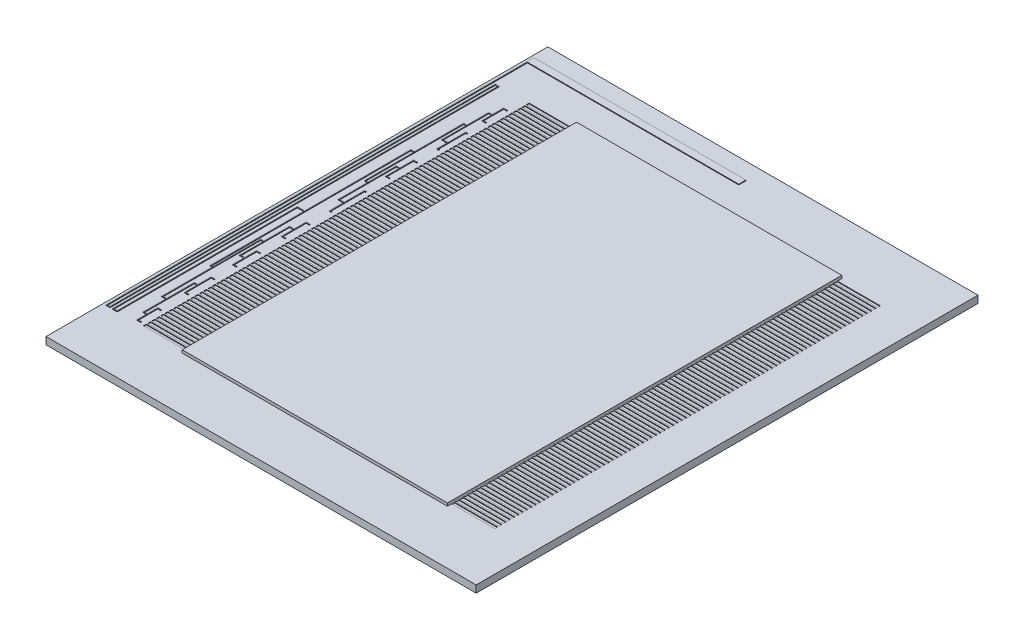
from build123d import *

# Parameters (mm, degrees)
SKETCH2_W           = 30
SKETCH2_H           = 35
BOSS_EXTRUDE1_DEPTH = 0.5
SKETCH4_W           = 3
SKETCH4_H           = 0.2
CUT_EXTRUDE1_DEPTH  = 0.05
SKETCH3_W           = 18.5
SKETCH3_H           = 27.5
BOSS_EXTRUDE5_DEPTH = 0.2
BOSS_EXTRUDE6_DEPTH = 0.05


with BuildPart() as part:
    # Sketch2 → Boss-Extrude1 (new body)
    with BuildSketch(Plane(origin=(0, 0, 0), x_dir=(1, 0, 0), z_dir=(0, 1, 0))):
        Rectangle(SKETCH2_W, SKETCH2_H)
    extrude(amount=-BOSS_EXTRUDE1_DEPTH)

    # Sketch4 → Cut-Extrude1 (cut)
    with BuildSketch(Plane(origin=(0, 0, 0), x_dir=(1, 0, 0), z_dir=(0, 1, 0))):
        with Locations((10.75, 13.35)):
            Rectangle(SKETCH4_W, SKETCH4_H)
        with Locations((10.75, 13.05)):
            Rectangle(SKETCH4_W, SKETCH4_H)
        with Locations((10.75, 12.75)):
            Rectangle(SKETCH4_W, SKETCH4_H)
        with Locations((10.75, 12.45)):
            Rectangle(SKETCH4_W, SKETCH4_H)
        with Locations((10.75, 12.15)):
            Rectangle(SKETCH4_W, SKETCH4_H)
        with Locations((10.75, 11.85)):
            Rectangle(SKETCH4_W, SKETCH4_H)
        with Locations((10.75, 11.55)):
            Rectangle(SKETCH4_W, SKETCH4_H)
        with Locations((10.75, 11.25)):
            Rectangle(SKETCH4_W, SKETCH4_H)
        with Locations((10.75, 10.95)):
            Rectangle(SKETCH4_W, SKETCH4_H)
        with Locations((10.75, 10.65)):
            Rectangle(SKETCH4_W, SKETCH4_H)
        with Locations((10.75, 10.35)):
            Rectangle(SKETCH4_W, SKETCH4_H)
        with Locations((10.75, 10.05)):
            Rectangle(SKETCH4_W, SKETCH4_H)
        with Locations((10.75, 9.75)):
            Rectangle(SKETCH4_W, SKETCH4_H)
        with Locations((10.75, 9.45)):
            Rectangle(SKETCH4_W, SKETCH4_H)
        with Locations((10.75, 9.15)):
            Rectangle(SKETCH4_W, SKETCH4_H)
        with Locations((10.75, 8.85)):
            Rectangle(SKETCH4_W, SKETCH4_H)
        with Locations((10.75, 8.55)):
            Rectangle(SKETCH4_W, SKETCH4_H)
        with Locations((10.75, 8.25)):
            Rectangle(SKETCH4_W, SKETCH4_H)
        with Locations((10.75, 7.95)):
            Rectangle(SKETCH4_W, SKETCH4_H)
        with Locations((10.75, 7.65)):
            Rectangle(SKETCH4_W, SKETCH4_H)
        with Locations((10.75, 7.35)):
            Rectangle(SKETCH4_W, SKETCH4_H)
        with Locations((10.75, 7.05)):
            Rectangle(SKETCH4_W, SKETCH4_H)
        with Locations((10.75, 6.75)):
            Rectangle(SKETCH4_W, SKETCH4_H)
        with Locations((10.75, 6.45)):
            Rectangle(SKETCH4_W, SKETCH4_H)
        with Locations((10.75, 6.15)):
            Rectangle(SKETCH4_W, SKETCH4_H)
        with Locations((10.75, 5.85)):
            Rectangle(SKETCH4_W, SKETCH4_H)
        with Locations((10.75, 5.55)):
            Rectangle(SKETCH4_W, SKETCH4_H)
        with Locations((10.75, 5.25)):
            Rectangle(SKETCH4_W, SKETCH4_H)
        with Locations((10.75, 4.95)):
            Rectangle(SKETCH4_W, SKETCH4_H)
        with Locations((10.75, 4.65)):
            Rectangle(SKETCH4_W, SKETCH4_H)
        with Locations((10.75, 4.35)):
            Rectangle(SKETCH4_W, SKETCH4_H)
        with Locations((10.75, 4.05)):
            Rectangle(SKETCH4_W, SKETCH4_H)
        with Locations((10.75, 3.75)):
            Rectangle(SKETCH4_W, SKETCH4_H)
        with Locations((10.75, 3.45)):
            Rectangle(SKETCH4_W, SKETCH4_H)
        with Locations((10.75, 3.15)):
            Rectangle(SKETCH4_W, SKETCH4_H)
        with Locations((10.75, 2.85)):
            Rectangle(SKETCH4_W, SKETCH4_H)
        with Locations((10.75, 2.55)):
            Rectangle(SKETCH4_W, SKETCH4_H)
        with Locations((10.75, 2.25)):
            Rectangle(SKETCH4_W, SKETCH4_H)
        with Locations((10.75, 1.95)):
            Rectangle(SKETCH4_W, SKETCH4_H)
        with Locations((10.75, 1.65)):
            Rectangle(SKETCH4_W, SKETCH4_H)
        with Locations((10.75, 1.35)):
            Rectangle(SKETCH4_W, SKETCH4_H)
        with Locations((10.75, 1.05)):
            Rectangle(SKETCH4_W, SKETCH4_H)
        with Locations((10.75, 0.75)):
            Rectangle(SKETCH4_W, SKETCH4_H)
        with Locations((10.75, 0.45)):
            Rectangle(SKETCH4_W, SKETCH4_H)
        with Locations((10.75, 0.15)):
            Rectangle(SKETCH4_W, SKETCH4_H)
        with Locations((10.75, -0.15)):
            Rectangle(SKETCH4_W, SKETCH4_H)
        with Locations((10.75, -0.45)):
            Rectangle(SKETCH4_W, SKETCH4_H)
        with Locations((10.75, -0.75)):
            Rectangle(SKETCH4_W, SKETCH4_H)
        with Locations((10.75, -1.05)):
            Rectangle(SKETCH4_W, SKETCH4_H)
        with Locations((10.75, -1.35)):
            Rectangle(SKETCH4_W, SKETCH4_H)
        with Locations((10.75, -1.65)):
            Rectangle(SKETCH4_W, SKETCH4_H)
        with Locations((10.75, -1.95)):
            Rectangle(SKETCH4_W, SKETCH4_H)
        with Locations((10.75, -2.25)):
            Rectangle(SKETCH4_W, SKETCH4_H)
        with Locations((10.75, -2.55)):
            Rectangle(SKETCH4_W, SKETCH4_H)
        with Locations((10.75, -2.85)):
            Rectangle(SKETCH4_W, SKETCH4_H)
        with Locations((10.75, -3.15)):
            Rectangle(SKETCH4_W, SKETCH4_H)
        with Locations((10.75, -3.45)):
            Rectangle(SKETCH4_W, SKETCH4_H)
        with Locations((10.75, -3.75)):
            Rectangle(SKETCH4_W, SKETCH4_H)
        with Locations((10.75, -4.05)):
            Rectangle(SKETCH4_W, SKETCH4_H)
        with Locations((10.75, -4.35)):
            Rectangle(SKETCH4_W, SKETCH4_H)
        with Locations((10.75, -4.65)):
            Rectangle(SKETCH4_W, SKETCH4_H)
        with Locations((10.75, -4.95)):
            Rectangle(SKETCH4_W, SKETCH4_H)
        with Locations((10.75, -5.25)):
            Rectangle(SKETCH4_W, SKETCH4_H)
        with Locations((10.75, -5.55)):
            Rectangle(SKETCH4_W, SKETCH4_H)
        with Locations((10.75, -5.85)):
            Rectangle(SKETCH4_W, SKETCH4_H)
        with Locations((10.75, -6.15)):
            Rectangle(SKETCH4_W, SKETCH4_H)
        with Locations((10.75, -6.45)):
            Rectangle(SKETCH4_W, SKETCH4_H)
        with Locations((10.75, -6.75)):
            Rectangle(SKETCH4_W, SKETCH4_H)
        with Locations((10.75, -7.05)):
            Rectangle(SKETCH4_W, SKETCH4_H)
        with Locations((10.75, -7.35)):
            Rectangle(SKETCH4_W, SKETCH4_H)
        with Locations((10.75, -7.65)):
            Rectangle(SKETCH4_W, SKETCH4_H)
        with Locations((10.75, -7.95)):
            Rectangle(SKETCH4_W, SKETCH4_H)
        with Locations((10.75, -8.25)):
            Rectangle(SKETCH4_W, SKETCH4_H)
        with Locations((10.75, -8.55)):
            Rectangle(SKETCH4_W, SKETCH4_H)
        with Locations((10.75, -8.85)):
            Rectangle(SKETCH4_W, SKETCH4_H)
        with Locations((10.75, -9.15)):
            Rectangle(SKETCH4_W, SKETCH4_H)
        with Locations((10.75, -9.45)):
            Rectangle(SKETCH4_W, SKETCH4_H)
        with Locations((10.75, -9.75)):
            Rectangle(SKETCH4_W, SKETCH4_H)
        with Locations((10.75, -10.05)):
            Rectangle(SKETCH4_W, SKETCH4_H)
        with Locations((10.75, -10.35)):
            Rectangle(SKETCH4_W, SKETCH4_H)
        with Locations((10.75, -10.65)):
            Rectangle(SKETCH4_W, SKETCH4_H)
        with Locations((10.75, -10.95)):
            Rectangle(SKETCH4_W, SKETCH4_H)
        with Locations((10.75, -11.25)):
            Rectangle(SKETCH4_W, SKETCH4_H)
        with Locations((10.75, -11.55)):
            Rectangle(SKETCH4_W, SKETCH4_H)
        with Locations((10.75, -11.85)):
            Rectangle(SKETCH4_W, SKETCH4_H)
        with Locations((10.75, -12.15)):
            Rectangle(SKETCH4_W, SKETCH4_H)
        with Locations((10.75, -12.45)):
            Rectangle(SKETCH4_W, SKETCH4_H)
        with Locations((10.75, -12.75)):
            Rectangle(SKETCH4_W, SKETCH4_H)
        with Locations((10.75, -13.05)):
            Rectangle(SKETCH4_W, SKETCH4_H)
        with Locations((10.75, -13.35)):
            Rectangle(SKETCH4_W, SKETCH4_H)
        with Locations((-10.75, 13.35)):
            Rectangle(SKETCH4_W, SKETCH4_H)
        with Locations((-10.75, 13.05)):
            Rectangle(SKETCH4_W, SKETCH4_H)
        with Locations((-10.75, 12.75)):
            Rectangle(SKETCH4_W, SKETCH4_H)
        with Locations((-10.75, 12.45)):
            Rectangle(SKETCH4_W, SKETCH4_H)
        with Locations((-10.75, 12.15)):
            Rectangle(SKETCH4_W, SKETCH4_H)
        with Locations((-10.75, 11.85)):
            Rectangle(SKETCH4_W, SKETCH4_H)
        with Locations((-10.75, 11.55)):
            Rectangle(SKETCH4_W, SKETCH4_H)
        with Locations((-10.75, 11.25)):
            Rectangle(SKETCH4_W, SKETCH4_H)
        with Locations((-10.75, 10.95)):
            Rectangle(SKETCH4_W, SKETCH4_H)
        with Locations((-10.75, 10.65)):
            Rectangle(SKETCH4_W, SKETCH4_H)
        with Locations((-10.75, 10.35)):
            Rectangle(SKETCH4_W, SKETCH4_H)
        with Locations((-10.75, 10.05)):
            Rectangle(SKETCH4_W, SKETCH4_H)
        with Locations((-10.75, 9.75)):
            Rectangle(SKETCH4_W, SKETCH4_H)
        with Locations((-10.75, 9.45)):
            Rectangle(SKETCH4_W, SKETCH4_H)
        with Locations((-10.75, 9.15)):
            Rectangle(SKETCH4_W, SKETCH4_H)
        with Locations((-10.75, 8.85)):
            Rectangle(SKETCH4_W, SKETCH4_H)
        with Locations((-10.75, 8.55)):
            Rectangle(SKETCH4_W, SKETCH4_H)
        with Locations((-10.75, 8.25)):
            Rectangle(SKETCH4_W, SKETCH4_H)
        with Locations((-10.75, 7.95)):
            Rectangle(SKETCH4_W, SKETCH4_H)
        with Locations((-10.75, 7.65)):
            Rectangle(SKETCH4_W, SKETCH4_H)
        with Locations((-10.75, 7.35)):
            Rectangle(SKETCH4_W, SKETCH4_H)
        with Locations((-10.75, 7.05)):
            Rectangle(SKETCH4_W, SKETCH4_H)
        with Locations((-10.75, 6.75)):
            Rectangle(SKETCH4_W, SKETCH4_H)
        with Locations((-10.75, 6.45)):
            Rectangle(SKETCH4_W, SKETCH4_H)
        with Locations((-10.75, 6.15)):
            Rectangle(SKETCH4_W, SKETCH4_H)
        with Locations((-10.75, 5.85)):
            Rectangle(SKETCH4_W, SKETCH4_H)
        with Locations((-10.75, 5.55)):
            Rectangle(SKETCH4_W, SKETCH4_H)
        with Locations((-10.75, 5.25)):
            Rectangle(SKETCH4_W, SKETCH4_H)
        with Locations((-10.75, 4.95)):
            Rectangle(SKETCH4_W, SKETCH4_H)
        with Locations((-10.75, 4.65)):
            Rectangle(SKETCH4_W, SKETCH4_H)
        with Locations((-10.75, 4.35)):
            Rectangle(SKETCH4_W, SKETCH4_H)
        with Locations((-10.75, 4.05)):
            Rectangle(SKETCH4_W, SKETCH4_H)
        with Locations((-10.75, 3.75)):
            Rectangle(SKETCH4_W, SKETCH4_H)
        with Locations((-10.75, 3.45)):
            Rectangle(SKETCH4_W, SKETCH4_H)
        with Locations((-10.75, 3.15)):
            Rectangle(SKETCH4_W, SKETCH4_H)
        with Locations((-10.75, 2.85)):
            Rectangle(SKETCH4_W, SKETCH4_H)
        with Locations((-10.75, 2.55)):
            Rectangle(SKETCH4_W, SKETCH4_H)
        with Locations((-10.75, 2.25)):
            Rectangle(SKETCH4_W, SKETCH4_H)
        with Locations((-10.75, 1.95)):
            Rectangle(SKETCH4_W, SKETCH4_H)
        with Locations((-10.75, 1.65)):
            Rectangle(SKETCH4_W, SKETCH4_H)
        with Locations((-10.75, 1.35)):
            Rectangle(SKETCH4_W, SKETCH4_H)
        with Locations((-10.75, 1.05)):
            Rectangle(SKETCH4_W, SKETCH4_H)
        with Locations((-10.75, 0.75)):
            Rectangle(SKETCH4_W, SKETCH4_H)
        with Locations((-10.75, 0.45)):
            Rectangle(SKETCH4_W, SKETCH4_H)
        with Locations((-10.75, 0.15)):
            Rectangle(SKETCH4_W, SKETCH4_H)
        with Locations((-10.75, -0.15)):
            Rectangle(SKETCH4_W, SKETCH4_H)
        with Locations((-10.75, -0.45)):
            Rectangle(SKETCH4_W, SKETCH4_H)
        with Locations((-10.75, -0.75)):
            Rectangle(SKETCH4_W, SKETCH4_H)
        with Locations((-10.75, -1.05)):
            Rectangle(SKETCH4_W, SKETCH4_H)
        with Locations((-10.75, -1.35)):
            Rectangle(SKETCH4_W, SKETCH4_H)
        with Locations((-10.75, -1.65)):
            Rectangle(SKETCH4_W, SKETCH4_H)
        with Locations((-10.75, -1.95)):
            Rectangle(SKETCH4_W, SKETCH4_H)
        with Locations((-10.75, -2.25)):
            Rectangle(SKETCH4_W, SKETCH4_H)
        with Locations((-10.75, -2.55)):
            Rectangle(SKETCH4_W, SKETCH4_H)
        with Locations((-10.75, -2.85)):
            Rectangle(SKETCH4_W, SKETCH4_H)
        with Locations((-10.75, -3.15)):
            Rectangle(SKETCH4_W, SKETCH4_H)
        with Locations((-10.75, -3.45)):
            Rectangle(SKETCH4_W, SKETCH4_H)
        with Locations((-10.75, -3.75)):
            Rectangle(SKETCH4_W, SKETCH4_H)
        with Locations((-10.75, -4.05)):
            Rectangle(SKETCH4_W, SKETCH4_H)
        with Locations((-10.75, -4.35)):
            Rectangle(SKETCH4_W, SKETCH4_H)
        with Locations((-10.75, -4.65)):
            Rectangle(SKETCH4_W, SKETCH4_H)
        with Locations((-10.75, -4.95)):
            Rectangle(SKETCH4_W, SKETCH4_H)
        with Locations((-10.75, -5.25)):
            Rectangle(SKETCH4_W, SKETCH4_H)
        with Locations((-10.75, -5.55)):
            Rectangle(SKETCH4_W, SKETCH4_H)
        with Locations((-10.75, -5.85)):
            Rectangle(SKETCH4_W, SKETCH4_H)
        with Locations((-10.75, -6.15)):
            Rectangle(SKETCH4_W, SKETCH4_H)
        with Locations((-10.75, -6.45)):
            Rectangle(SKETCH4_W, SKETCH4_H)
        with Locations((-10.75, -6.75)):
            Rectangle(SKETCH4_W, SKETCH4_H)
        with Locations((-10.75, -7.05)):
            Rectangle(SKETCH4_W, SKETCH4_H)
        with Locations((-10.75, -7.35)):
            Rectangle(SKETCH4_W, SKETCH4_H)
        with Locations((-10.75, -7.65)):
            Rectangle(SKETCH4_W, SKETCH4_H)
        with Locations((-10.75, -7.95)):
            Rectangle(SKETCH4_W, SKETCH4_H)
        with Locations((-10.75, -8.25)):
            Rectangle(SKETCH4_W, SKETCH4_H)
        with Locations((-10.75, -8.55)):
            Rectangle(SKETCH4_W, SKETCH4_H)
        with Locations((-10.75, -8.85)):
            Rectangle(SKETCH4_W, SKETCH4_H)
        with Locations((-10.75, -9.15)):
            Rectangle(SKETCH4_W, SKETCH4_H)
        with Locations((-10.75, -9.45)):
            Rectangle(SKETCH4_W, SKETCH4_H)
        with Locations((-10.75, -9.75)):
            Rectangle(SKETCH4_W, SKETCH4_H)
        with Locations((-10.75, -10.05)):
            Rectangle(SKETCH4_W, SKETCH4_H)
        with Locations((-10.75, -10.35)):
            Rectangle(SKETCH4_W, SKETCH4_H)
        with Locations((-10.75, -10.65)):
            Rectangle(SKETCH4_W, SKETCH4_H)
        with Locations((-10.75, -10.95)):
            Rectangle(SKETCH4_W, SKETCH4_H)
        with Locations((-10.75, -11.25)):
            Rectangle(SKETCH4_W, SKETCH4_H)
        with Locations((-10.75, -11.55)):
            Rectangle(SKETCH4_W, SKETCH4_H)
        with Locations((-10.75, -11.85)):
            Rectangle(SKETCH4_W, SKETCH4_H)
        with Locations((-10.75, -12.15)):
            Rectangle(SKETCH4_W, SKETCH4_H)
        with Locations((-10.75, -12.45)):
            Rectangle(SKETCH4_W, SKETCH4_H)
        with Locations((-10.75, -12.75)):
            Rectangle(SKETCH4_W, SKETCH4_H)
        with Locations((-10.75, -13.05)):
            Rectangle(SKETCH4_W, SKETCH4_H)
        with Locations((-10.75, -13.35)):
            Rectangle(SKETCH4_W, SKETCH4_H)
    extrude(amount=-CUT_EXTRUDE1_DEPTH, mode=Mode.SUBTRACT)

    # Sketch3 → Boss-Extrude5 (add)
    with BuildSketch(Plane(origin=(0, 0, 0), x_dir=(1, 0, 0), z_dir=(0, 1, 0))):
        Rectangle(SKETCH3_W, SKETCH3_H)
    extrude(amount=BOSS_EXTRUDE5_DEPTH)

    # Sketch5 → Boss-Extrude6 (add)
    with BuildSketch(Plane(origin=(0, 0, 0), x_dir=(1, 0, 0), z_dir=(0, 1, 0))):
        Polygon((0, 15.812273496), (0, 16.314175055), (-14.789626068, 16.314175055), (-14.789626068, -13.528494617), (-14.508787828, -13.528494617), (-14.508787828, 13.332781186), (-14.333817933, 13.332781186), (-14.333817933, -13.532159073), (-14.004212493, -13.532159073), (-14.004212493, -0.967892836), (-13.539057998, -0.967892836), (-13.539057998, -7.517465921), (-13.366836285, -7.517465921), (-13.366836285, -11.063446754), (-13.065268293, -11.063446754), (-13.065268293, -12.668132746), (-12.81439778, -12.668132746), (-12.81439778, -13.353240949), (-12.55, -13.353240949), (-12.55, -13.303240949), (-12.76439778, -13.303240949), (-12.76439778, -11.932560393), (-12.55, -11.932560393), (-12.55, -11.882560393), (-12.81439778, -11.882560393), (-12.81439778, -12.618132746), (-13.015268293, -12.618132746), (-13.015268293, -9.135218659), (-12.81439778, -9.135218659), (-12.81439778, -10.037865571), (-12.55, -10.037865571), (-12.55, -9.987865571), (-12.76439778, -9.987865571), (-12.76439778, -8.21164949), (-12.55, -8.21164949), (-12.55, -8.16164949), (-12.81439778, -8.16164949), (-12.81439778, -9.085218659), (-13.065268293, -9.085218659), (-13.065268293, -11.013446754), (-13.316836285, -11.013446754), (-13.316836285, -4.210640325), (-13.138104321, -4.210640325), (-13.138104321, -5.864398541), (-12.81439778, -5.864398541), (-12.81439778, -6.673198628), (-12.55, -6.673198628), (-12.55, -6.623198628), (-12.76439778, -6.623198628), (-12.76439778, -5.045439769), (-12.55, -5.045439769), (-12.55, -4.995439769), (-12.81439778, -4.995439769), (-12.81439778, -5.814398541), (-13.088104321, -5.814398541), (-13.088104321, -2.423869684), (-12.81439778, -2.423869684), (-12.81439778, -3.26341115), (-12.55, -3.26341115), (-12.55, -3.21341115), (-12.76439778, -3.21341115), (-12.76439778, -1.593852208), (-12.55, -1.593852208), (-12.55, -1.543852208), (-12.81439778, -1.543852208), (-12.81439778, -2.373869684), (-13.138104321, -2.373869684), (-13.138104321, -4.160640325), (-13.366836285, -4.160640325), (-13.366836285, -7.467465921), (-13.489057998, -7.467465921), (-13.489057998, 6.440147199), (-13.288005126, 6.440147199), (-13.288005126, 2.998754439), (-13.065268293, 2.998754439), (-13.065268293, 0.934167884), (-12.680974252, 0.934167884), (-12.680974252, -0.05), (-12.55, -0.05), (-12.55, 0), (-12.630974252, 0), (-12.630974252, 2.345277137), (-12.55, 2.345277137), (-12.55, 2.395277137), (-12.680974252, 2.395277137), (-12.680974252, 0.984167884), (-13.015268293, 0.984167884), (-13.015268293, 4.95418511), (-12.81439778, 4.95418511), (-12.81439778, 3.993137342), (-12.55, 3.993137342), (-12.55, 4.043137342), (-12.76439778, 4.043137342), (-12.76439778, 5.898689493), (-12.55, 5.898689493), (-12.55, 5.948689493), (-12.81439778, 5.948689493), (-12.81439778, 5.00418511), (-13.065268293, 5.00418511), (-13.065268293, 3.048754439), (-13.238005126, 3.048754439), (-13.238005126, 9.868878493), (-13.065268293, 9.868878493), (-13.065268293, 8.162283429), (-12.680974252, 8.162283429), (-12.680974252, 7.443451311), (-12.55, 7.443451311), (-12.55, 7.493451311), (-12.630974252, 7.493451311), (-12.630974252, 9.399327106), (-12.55, 9.399327106), (-12.55, 9.449327106), (-12.680974252, 9.449327106), (-12.680974252, 8.212283429), (-13.015268293, 8.212283429), (-13.015268293, 11.391004035), (-12.81439778, 11.391004035), (-12.81439778, 10.719876345), (-12.55, 10.719876345), (-12.55, 10.769876345), (-12.76439778, 10.769876345), (-12.76439778, 12.178883219), (-12.55, 12.178883219), (-12.55, 12.228883219), (-12.811634016, 12.228883219), (-12.81439778, 12.225016499), (-12.81439778, 11.441004035), (-13.065268293, 11.441004035), (-13.065268293, 9.918878493), (-13.288005126, 9.918878493), (-13.288005126, 6.490147199), (-13.539057998, 6.490147199), (-13.539057998, -0.917892836), (-14.054212493, -0.917892836), (-14.054212493, -13.482159073), (-14.283817933, -13.482159073), (-14.283817933, 13.382781186), (-14.558787828, 13.382781186), (-14.558787828, -13.478494617), (-14.739626068, -13.478494617), (-14.739626068, 15.812273496), align=None)
    extrude(amount=BOSS_EXTRUDE6_DEPTH)


solid = part.part
